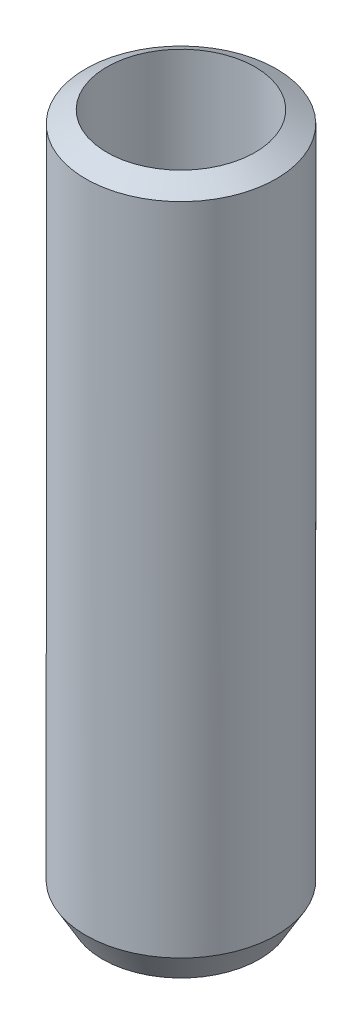
from build123d import *

# Parameters (mm, degrees)
SKETCH1_R           = 27.5
BOSS_EXTRUDE1_DEPTH = 202.297192
SKETCH2_R           = 21.37743673
CUT_EXTRUDE1_DEPTH  = 207.001587108
CHAMFER1_SIZE       = 4.865279
CHAMFER1_SIZE_2     = 8.42691


with BuildPart() as part:
    # Sketch1 → Boss-Extrude1 (new body)
    with BuildSketch(Plane(origin=(0, 0, 0), x_dir=(1, 0, 0), z_dir=(0, 1, 0))):
        with Locations(Location((0, 0, 0), (0, 0, 90))):
            Circle(SKETCH1_R)
    extrude(amount=BOSS_EXTRUDE1_DEPTH)

    # Sketch2 → Cut-Extrude1 (cut, through all)
    with BuildSketch(Plane(origin=(0, 0, 0), x_dir=(1, 0, 0), z_dir=(0, 1, 0))):
        with Locations(Location((0, 0, 0), (0, 0, 90))):
            Circle(SKETCH2_R)
    extrude(amount=CUT_EXTRUDE1_DEPTH, mode=Mode.SUBTRACT)

    # Chamfer1
    # the kernel refuses this chamfer: 8.42691, 4.865279 mm, written as the material it takes off along each edge
    with BuildSketch(Plane(origin=(0, 202.297192, 0), x_dir=(0, 0, -1), z_dir=(1, 0, 0))) as chamfer1_piece_1:
        Polygon((27.5, -CHAMFER1_SIZE), (27.5 - CHAMFER1_SIZE_2, 0), (27.5, 0), align=None)
    revolve(axis=Axis((0, 202.297192, 0), (0, 1, 0)), mode=Mode.SUBTRACT)
    with BuildSketch(Plane(origin=(0, 0, 0), x_dir=(0, 0, -1), z_dir=(1, 0, 0))) as chamfer1_piece_2:
        Polygon((27.5, CHAMFER1_SIZE_2), (27.5 - CHAMFER1_SIZE, 0), (27.5, 0), align=None)
    revolve(axis=Axis((0, 0, 0), (0, 1, 0)), mode=Mode.SUBTRACT)


solid = part.part
